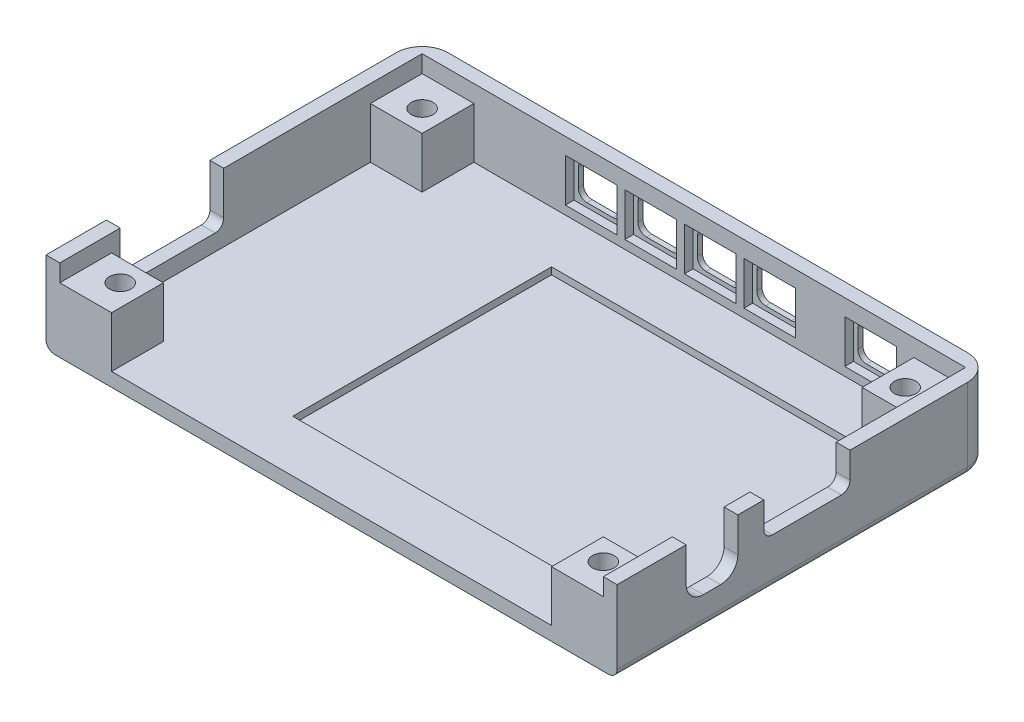
from build123d import *

# Parameters (mm, degrees)
SKETCH_1_W             = 63
SKETCH_1_H             = 42
EXTRUDE_298_DEPTH      = 1.6
SKETCH_2_W             = 42
SKETCH_2_H             = 30
CUT_EXTRUDE_670_DEPTH  = 0.8
SKETCH_4_W             = 1.6
SKETCH_4_H             = 42
EXTRUDE_914_DEPTH      = 9.5
SKETCH_5_W             = 6
SKETCH_5_H             = 6
EXTRUDE_1303_DEPTH     = 5.9
SKETCH_6_R             = 1.25
CUT_EXTRUDE_1636_DEPTH = 7.9
SKETCH_9_W             = 66.2
SKETCH_9_H             = 9.5
EXTRUDE_4_DEPTH        = 1.6
SKETCH_10_W            = 6
SKETCH_10_H            = 5
CUT_EXTRUDE_2759_DEPTH = 1
CUT_EXTRUDE_3267_REACH = 56.836
FILLET_4_R             = 1
FILLET_5_R             = 3
TF_REACH               = 70.894
CUT_EXTRUDE_1_REACH    = 70.894


with BuildPart() as part:
    # 草图1 → Extrude 298 (new body)
    with BuildSketch(Plane(origin=(0, 0, 0), x_dir=(1, 0, 0), z_dir=(0, 1, 0))):
        Rectangle(SKETCH_1_W, SKETCH_1_H)
    extrude(amount=-EXTRUDE_298_DEPTH)

    # 草图2 → Cut-Extrude 670 (cut)
    with BuildSketch(Plane(origin=(0, 0, 0), x_dir=(1, 0, 0), z_dir=(0, 1, 0))):
        with Locations((10.5, 0)):
            Rectangle(SKETCH_2_W, SKETCH_2_H)
    extrude(amount=-CUT_EXTRUDE_670_DEPTH, mode=Mode.SUBTRACT)

    # 草图4 → Extrude 914 (add)
    with BuildSketch(Plane(origin=(0, -1.6, 0), x_dir=(-1, 0, 0), z_dir=(0, -1, 0))):
        with Locations((-32.3, 0)):
            Rectangle(SKETCH_4_W, SKETCH_4_H)
        with Locations((32.3, 0)):
            Rectangle(SKETCH_4_W, SKETCH_4_H)
    extrude(amount=-EXTRUDE_914_DEPTH)

    # 草图5 → Extrude 1303 (add)
    with BuildSketch(Plane(origin=(0, 0, 0), x_dir=(1, 0, 0), z_dir=(0, 1, 0))):
        with Locations((-28.5, 18)):
            Rectangle(SKETCH_5_W, SKETCH_5_H)
        with Locations((28.5, 18)):
            Rectangle(SKETCH_5_W, SKETCH_5_H)
        with Locations((-28.5, -18)):
            Rectangle(SKETCH_5_W, SKETCH_5_H)
        with Locations((28.5, -18)):
            Rectangle(SKETCH_5_W, SKETCH_5_H)
    extrude(amount=EXTRUDE_1303_DEPTH)

    # 草图6 → Cut-Extrude 1636 (cut)
    with BuildSketch(Plane(origin=(0, 7.9, 0), x_dir=(1, 0, 0), z_dir=(0, 1, 0))):
        with Locations(Location((-28, 17.5, 0), (0, 0, 270))):
            Circle(SKETCH_6_R)
        with Locations(Location((28, 17.5, 0), (0, 0, 270))):
            Circle(SKETCH_6_R)
        with Locations(Location((28, -17.5, 0), (0, 0, 270))):
            Circle(SKETCH_6_R)
        with Locations(Location((-28, -17.5, 0), (0, 0, 270))):
            Circle(SKETCH_6_R)
    extrude(amount=-CUT_EXTRUDE_1636_DEPTH, mode=Mode.SUBTRACT)

    # 草图9 → 凸台-拉伸4 (add)
    with BuildSketch(Plane(origin=(0, 0, -21), x_dir=(-1, 0, 0), z_dir=(0, 0, -1))):
        with Locations((0, 3.15)):
            Rectangle(SKETCH_9_W, SKETCH_9_H)
    extrude(amount=EXTRUDE_4_DEPTH)

    # 草图10 → Cut-Extrude 2759 (cut)
    with BuildSketch(Plane.XY.offset(-21)):
        with Locations((20.5, 3.5)):
            Rectangle(SKETCH_10_W, SKETCH_10_H)
        with Locations((8.8, 3.5)):
            Rectangle(SKETCH_10_W, SKETCH_10_H)
        with Locations((1.9, 3.5)):
            Rectangle(SKETCH_10_W, SKETCH_10_H)
        with Locations((-5, 3.5)):
            Rectangle(SKETCH_10_W, SKETCH_10_H)
        with Locations((-11.9, 3.5)):
            Rectangle(SKETCH_10_W, SKETCH_10_H)
    extrude(amount=-CUT_EXTRUDE_2759_DEPTH, mode=Mode.SUBTRACT)

    # 草图12 → Cut-Extrude 3267 (cut, up to next)
    with BuildSketch(Plane.XY.offset(-22), mode=Mode.PRIVATE) as cut_extrude_3267_sk1:
        with BuildLine():
            Line((6.3, 2.5), (6.3, 4.5))
            ThreePointArc((6.3, 4.5), (6.592893219, 5.207106781), (7.3, 5.5))
            Line((7.3, 5.5), (10.3, 5.5))
            ThreePointArc((10.3, 5.5), (11.007106781, 5.207106781), (11.3, 4.5))
            Line((11.3, 4.5), (11.3, 2.5))
            ThreePointArc((11.3, 2.5), (11.007106781, 1.792893219), (10.3, 1.5))
            Line((10.3, 1.5), (7.3, 1.5))
            ThreePointArc((7.3, 1.5), (6.592893219, 1.792893219), (6.3, 2.5))
        make_face()
    cut_extrude_3267_tool1 = extrude(cut_extrude_3267_sk1.sketch, amount=-CUT_EXTRUDE_3267_REACH, mode=Mode.PRIVATE) & part.part
    # 草图12 → Cut-Extrude 3267 (cut, up to next)
    with BuildSketch(Plane.XY.offset(-22), mode=Mode.PRIVATE) as cut_extrude_3267_sk2:
        with BuildLine():
            Line((19, 1.5), (22, 1.5))
            ThreePointArc((22, 1.5), (22.707106781, 1.792893219), (23, 2.5))
            Line((23, 2.5), (23, 4.5))
            ThreePointArc((23, 4.5), (22.707106781, 5.207106781), (22, 5.5))
            Line((22, 5.5), (19, 5.5))
            ThreePointArc((19, 5.5), (18.292893219, 5.207106781), (18, 4.5))
            Line((18, 4.5), (18, 2.5))
            ThreePointArc((18, 2.5), (18.292893219, 1.792893219), (19, 1.5))
        make_face()
    cut_extrude_3267_tool2 = extrude(cut_extrude_3267_sk2.sketch, amount=-CUT_EXTRUDE_3267_REACH, mode=Mode.PRIVATE) & part.part
    # 草图12 → Cut-Extrude 3267 (cut, up to next)
    with BuildSketch(Plane.XY.offset(-22), mode=Mode.PRIVATE) as cut_extrude_3267_sk3:
        with BuildLine():
            Line((-0.6, 2.5), (-0.6, 4.5))
            ThreePointArc((-0.6, 4.5), (-0.307106781, 5.207106781), (0.4, 5.5))
            Line((0.4, 5.5), (3.4, 5.5))
            ThreePointArc((3.4, 5.5), (4.107106781, 5.207106781), (4.4, 4.5))
            Line((4.4, 4.5), (4.4, 2.5))
            ThreePointArc((4.4, 2.5), (4.107106781, 1.792893219), (3.4, 1.5))
            Line((3.4, 1.5), (0.4, 1.5))
            ThreePointArc((0.4, 1.5), (-0.307106781, 1.792893219), (-0.6, 2.5))
        make_face()
    cut_extrude_3267_tool3 = extrude(cut_extrude_3267_sk3.sketch, amount=-CUT_EXTRUDE_3267_REACH, mode=Mode.PRIVATE) & part.part
    # 草图12 → Cut-Extrude 3267 (cut, up to next)
    with BuildSketch(Plane.XY.offset(-22), mode=Mode.PRIVATE) as cut_extrude_3267_sk4:
        with BuildLine():
            Line((-7.5, 2.5), (-7.5, 4.5))
            ThreePointArc((-7.5, 4.5), (-7.207106781, 5.207106781), (-6.5, 5.5))
            Line((-6.5, 5.5), (-3.5, 5.5))
            ThreePointArc((-3.5, 5.5), (-2.792893219, 5.207106781), (-2.5, 4.5))
            Line((-2.5, 4.5), (-2.5, 2.5))
            ThreePointArc((-2.5, 2.5), (-2.792893219, 1.792893219), (-3.5, 1.5))
            Line((-3.5, 1.5), (-6.5, 1.5))
            ThreePointArc((-6.5, 1.5), (-7.207106781, 1.792893219), (-7.5, 2.5))
        make_face()
    cut_extrude_3267_tool4 = extrude(cut_extrude_3267_sk4.sketch, amount=-CUT_EXTRUDE_3267_REACH, mode=Mode.PRIVATE) & part.part
    # 草图12 → Cut-Extrude 3267 (cut, up to next)
    with BuildSketch(Plane.XY.offset(-22), mode=Mode.PRIVATE) as cut_extrude_3267_sk5:
        with BuildLine():
            Line((-14.4, 2.5), (-14.4, 4.5))
            ThreePointArc((-14.4, 4.5), (-14.107106781, 5.207106781), (-13.4, 5.5))
            Line((-13.4, 5.5), (-10.4, 5.5))
            ThreePointArc((-10.4, 5.5), (-9.692893219, 5.207106781), (-9.4, 4.5))
            Line((-9.4, 4.5), (-9.4, 2.5))
            ThreePointArc((-9.4, 2.5), (-9.692893219, 1.792893219), (-10.4, 1.5))
            Line((-10.4, 1.5), (-13.4, 1.5))
            ThreePointArc((-13.4, 1.5), (-14.107106781, 1.792893219), (-14.4, 2.5))
        make_face()
    cut_extrude_3267_tool5 = extrude(cut_extrude_3267_sk5.sketch, amount=-CUT_EXTRUDE_3267_REACH, mode=Mode.PRIVATE) & part.part
    add(cut_extrude_3267_tool1.solids().sort_by_distance((8.8, 3.5, -22))[0], mode=Mode.SUBTRACT)
    add(cut_extrude_3267_tool2.solids().sort_by_distance((20.5, 3.5, -22))[0], mode=Mode.SUBTRACT)
    add(cut_extrude_3267_tool3.solids().sort_by_distance((1.9, 3.5, -22))[0], mode=Mode.SUBTRACT)
    add(cut_extrude_3267_tool4.solids().sort_by_distance((-5, 3.5, -22))[0], mode=Mode.SUBTRACT)
    add(cut_extrude_3267_tool5.solids().sort_by_distance((-11.9, 3.5, -22))[0], mode=Mode.SUBTRACT)

    # 圆角4
    fillet_4_edges = [part.edges().sort_by_distance(p)[0] for p in [
        (0, -1.6, -22.6),
        (33.1, -1.6, -0.8),
        (-33.1, -1.6, -0.8),
    ]]
    fillet(fillet_4_edges, radius=FILLET_4_R)

    # 圆角5
    # the kernel refuses this fillet: 3 mm, written as the material it takes off along each edge
    with BuildSketch(Plane(origin=(30.1, -1.6, -19.6), x_dir=(0, 0, -1), z_dir=(-1, 0, 0))) as fillet_5_piece_1:
        with BuildLine():
            CenterArc((2, -1), 1, 0, 90)
            Line((3, -1), (3, 0))
            Line((3, 0), (2, 0))
        make_face()
    revolve(axis=Axis((30.1, -1.6, -19.6), (0, -1, 0)), revolution_arc=90, mode=Mode.SUBTRACT)
    with BuildSketch(Plane(origin=(-30.1, -1.6, -19.6), x_dir=(-1, 0, 0), z_dir=(0, 0, 1))) as fillet_5_piece_2:
        with BuildLine():
            CenterArc((2, -1), 1, 0, 90)
            Line((3, -1), (3, 0))
            Line((3, 0), (2, 0))
        make_face()
    revolve(axis=Axis((-30.1, -1.6, -19.6), (0, -1, 0)), revolution_arc=90, mode=Mode.SUBTRACT)
    with BuildSketch(Plane(origin=(33.1, 15.4, -22.6), x_dir=(0, 0, 1), z_dir=(0, -1, 0)), Plane(origin=(-33.1, -1.6, -22.6), x_dir=(0, 0, 1), z_dir=(0, 1, 0))) as fillet_5_piece_3:
        with BuildLine():
            CenterArc((FILLET_5_R, FILLET_5_R), FILLET_5_R, 180, 90)
            Line((0, FILLET_5_R), (0, 0))
            Line((0, 0), (FILLET_5_R, 0))
        make_face()
    extrude(amount=17, mode=Mode.SUBTRACT)

    # 草图16 → tf (cut, up to next)
    with BuildSketch(Plane(origin=(-31.5, 0, 0), x_dir=(0, 0, -1), z_dir=(1, 0, 0)), mode=Mode.PRIVATE) as tf_sk1:
        with BuildLine():
            Line((-14, 7.9), (-2, 7.9))
            Line((-2, 7.9), (-2, 2.9))
            ThreePointArc((-2, 2.9), (-2.292893219, 2.192893219), (-3, 1.9))
            Line((-3, 1.9), (-13, 1.9))
            ThreePointArc((-13, 1.9), (-13.707106781, 2.192893219), (-14, 2.9))
            Line((-14, 2.9), (-14, 7.9))
        make_face()
    tf_tool1 = extrude(tf_sk1.sketch, amount=-TF_REACH, mode=Mode.PRIVATE) & part.part
    add(tf_tool1.solids().sort_by_distance((-31.5, 4.916651, 8))[0], mode=Mode.SUBTRACT)

    # 草图17 → 切除-拉伸1 (cut, up to next)
    with BuildSketch(Plane.ZY.offset(-31.5), mode=Mode.PRIVATE) as cut_extrude_1_sk1:
        with BuildLine():
            Line((7, 7.9), (13, 7.9))
            Line((13, 7.9), (13, 3.9))
            ThreePointArc((13, 3.9), (12.414213562, 2.485786438), (11, 1.9))
            Line((11, 1.9), (9, 1.9))
            ThreePointArc((9, 1.9), (7.585786438, 2.485786438), (7, 3.9))
            Line((7, 3.9), (7, 7.9))
        make_face()
    cut_extrude_1_tool1 = extrude(cut_extrude_1_sk1.sketch, amount=-CUT_EXTRUDE_1_REACH, mode=Mode.PRIVATE) & part.part
    # 草图17 → 切除-拉伸1 (cut, up to next)
    with BuildSketch(Plane.ZY.offset(-31.5), mode=Mode.PRIVATE) as cut_extrude_1_sk2:
        with BuildLine():
            Line((4, 7.9), (-6, 7.9))
            Line((-6, 7.9), (-6, 4.9))
            ThreePointArc((-6, 4.9), (-5.707106781, 4.192893219), (-5, 3.9))
            Line((-5, 3.9), (3, 3.9))
            ThreePointArc((3, 3.9), (3.707106781, 4.192893219), (4, 4.9))
            Line((4, 4.9), (4, 7.9))
        make_face()
    cut_extrude_1_tool2 = extrude(cut_extrude_1_sk2.sketch, amount=-CUT_EXTRUDE_1_REACH, mode=Mode.PRIVATE) & part.part
    add(cut_extrude_1_tool1.solids().sort_by_distance((31.5, 5.027861, 10))[0], mode=Mode.SUBTRACT)
    add(cut_extrude_1_tool2.solids().sort_by_distance((31.5, 5.91927, -1))[0], mode=Mode.SUBTRACT)


solid = part.part
